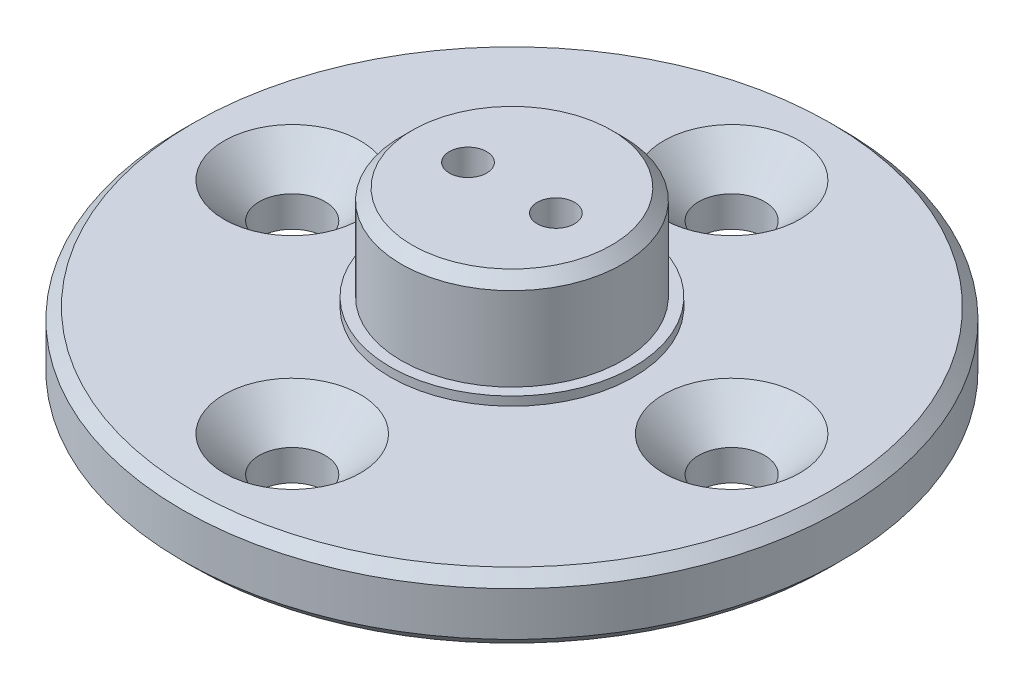
from build123d import *

# Parameters (mm, degrees)
SKETCH_1_R      = 15
SKETCH_1_R_2    = 1.5
EXTRUDE_1_DEPTH = 3
SKETCH_2_R      = 5.035
SKETCH_2_R_2    = 0.85
EXTRUDE_2_DEPTH = 4.7
SKETCH_4_R      = 5.535
EXTRUDE_3_DEPTH = 0.4
CHAMFER_1_SIZE  = 0.5
CHAMFER_3_SIZE  = 0.5
CHAMFER_4_SIZE  = 1.6


with BuildPart() as part:
    # 草图1 → 凸台-拉伸1 (new body)
    with BuildSketch(Plane(origin=(0, 0, 0), x_dir=(1, 0, 0), z_dir=(0, 1, 0))):
        Circle(SKETCH_1_R)
        with Locations((0, 10)):
            Circle(SKETCH_1_R_2, mode=Mode.SUBTRACT)
        with Locations((10, 0)):
            Circle(SKETCH_1_R_2, mode=Mode.SUBTRACT)
        with Locations((0, -10)):
            Circle(SKETCH_1_R_2, mode=Mode.SUBTRACT)
        with Locations((-10, 0)):
            Circle(SKETCH_1_R_2, mode=Mode.SUBTRACT)
    extrude(amount=EXTRUDE_1_DEPTH)

    # 草图2 → 凸台-拉伸2 (add)
    with BuildSketch(Plane(origin=(0, 3, 0), x_dir=(1, 0, 0), z_dir=(0, 1, 0))):
        Circle(SKETCH_2_R)
        with Locations((2, 0)):
            Circle(SKETCH_2_R_2, mode=Mode.SUBTRACT)
        with Locations((-2, 0)):
            Circle(SKETCH_2_R_2, mode=Mode.SUBTRACT)
    extrude(amount=EXTRUDE_2_DEPTH)

    # 草图4 → 凸台-拉伸3 (add)
    with BuildSketch(Plane(origin=(0, 3, 0), x_dir=(1, 0, 0), z_dir=(0, 1, 0))):
        Circle(SKETCH_4_R)
    extrude(amount=EXTRUDE_3_DEPTH)

    # 倒角1
    chamfer_1_edges = [part.edges().sort_by_distance(p)[0] for p in [
        (-5.035, 7.7, 0),
    ]]
    chamfer(chamfer_1_edges, length=CHAMFER_1_SIZE)

    # 倒角3
    chamfer_3_edges = [part.edges().sort_by_distance(p)[0] for p in [
        (-15, 0, 0),
        (-15, 3, 0),
    ]]
    chamfer(chamfer_3_edges, length=CHAMFER_3_SIZE)

    # 倒角4
    chamfer_4_edges = [part.edges().sort_by_distance(p)[0] for p in [
        (8.5, 3, 0),
        (-1.5, 3, 10),
        (-11.5, 3, 0),
        (-1.5, 3, -10),
    ]]
    chamfer(chamfer_4_edges, length=CHAMFER_4_SIZE)


solid = part.part
